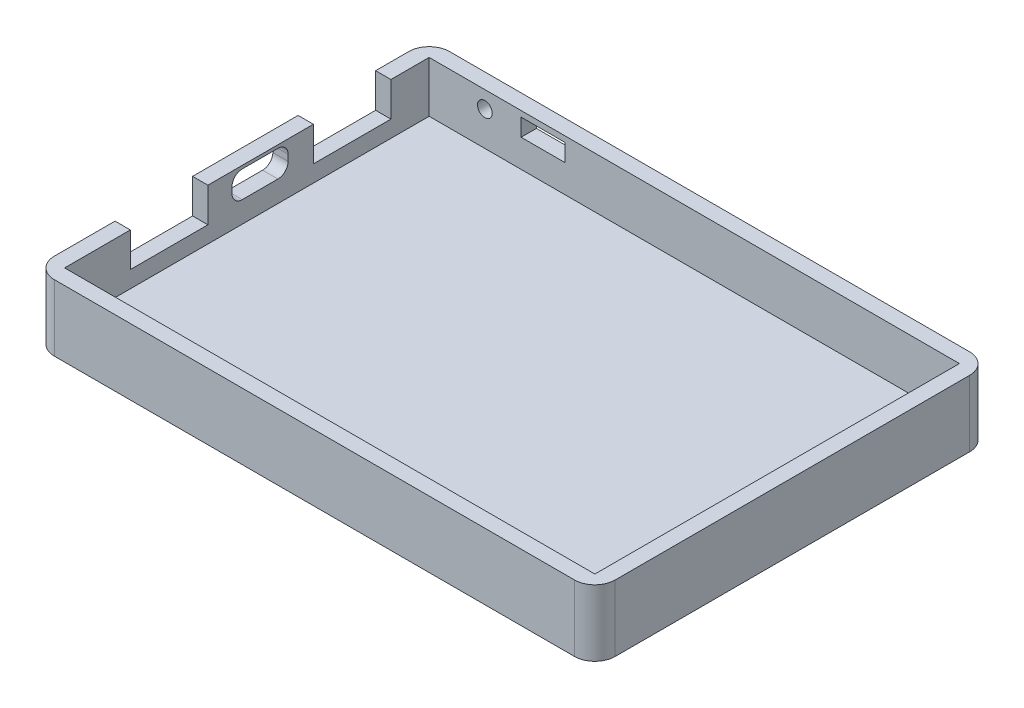
from build123d import *

# Parameters (mm, degrees)
SKETCH1_W           = 110
SKETCH1_H           = 77.5
SKETCH1_W_2         = 104
SKETCH1_H_2         = 71.5
BOSS_EXTRUDE1_DEPTH = 10
SKETCH1_2_W         = 110
SKETCH1_2_H         = 77.5
BOSS_EXTRUDE2_DEPTH = 3
CUT_EXTRUDE1_REACH  = 136.931
SKETCH3_W           = 15.2
SKETCH3_H           = 6.73
CUT_EXTRUDE2_REACH  = 136.931
SKETCH4_R           = 1.45
SKETCH4_W           = 8.6
SKETCH4_H           = 3.42
FILLET1_R           = 4


with BuildPart() as part:
    # Sketch1 → Boss-Extrude1 (new body)
    with BuildSketch(Plane(origin=(0, 0, 0), x_dir=(1, 0, 0), z_dir=(0, 1, 0))):
        with Locations((55, 38.75)):
            Rectangle(SKETCH1_W, SKETCH1_H)
        with Locations((55, 38.75)):
            Rectangle(SKETCH1_W_2, SKETCH1_H_2, mode=Mode.SUBTRACT)
    extrude(amount=BOSS_EXTRUDE1_DEPTH)

    # Sketch1<2> → Boss-Extrude2 (add)
    with BuildSketch(Plane(origin=(0, 0, 0), x_dir=(1, 0, 0), z_dir=(0, 1, 0))):
        with Locations((55, 38.75)):
            Rectangle(SKETCH1_2_W, SKETCH1_2_H)
    extrude(amount=-BOSS_EXTRUDE2_DEPTH)

    # Sketch3 → Cut-Extrude1 (cut, up to next)
    with BuildSketch(Plane.ZY, mode=Mode.PRIVATE) as cut_extrude1_sk1:
        with Locations((-23.5, 6.635)):
            Rectangle(SKETCH3_W, SKETCH3_H)
    cut_extrude1_tool1 = extrude(cut_extrude1_sk1.sketch, amount=-CUT_EXTRUDE1_REACH, mode=Mode.PRIVATE) & part.part
    # Sketch3 → Cut-Extrude1 (cut, up to next)
    with BuildSketch(Plane.ZY, mode=Mode.PRIVATE) as cut_extrude1_sk2:
        with Locations((-59.4, 6.635)):
            Rectangle(SKETCH3_W, SKETCH3_H)
    cut_extrude1_tool2 = extrude(cut_extrude1_sk2.sketch, amount=-CUT_EXTRUDE1_REACH, mode=Mode.PRIVATE) & part.part
    # Sketch3 → Cut-Extrude1 (cut, up to next)
    with BuildSketch(Plane.ZY, mode=Mode.PRIVATE) as cut_extrude1_sk3:
        with BuildLine():
            Line((-37.84, 9.38), (-44.840000134, 9.38))
            ThreePointArc((-44.840000134, 9.38), (-46.254213696, 8.794213562), (-46.840000134, 7.38))
            Line((-46.840000134, 7.38), (-46.840000134, 6.18))
            ThreePointArc((-46.840000134, 6.18), (-46.254213696, 4.765786438), (-44.840000134, 4.18))
            Line((-44.840000134, 4.18), (-37.84, 4.18))
            ThreePointArc((-37.84, 4.18), (-36.425786438, 4.765786438), (-35.84, 6.18))
            Line((-35.84, 6.18), (-35.84, 7.38))
            ThreePointArc((-35.84, 7.38), (-36.425786438, 8.794213562), (-37.84, 9.38))
        make_face()
    cut_extrude1_tool3 = extrude(cut_extrude1_sk3.sketch, amount=-CUT_EXTRUDE1_REACH, mode=Mode.PRIVATE) & part.part
    add(cut_extrude1_tool1.solids().sort_by_distance((0, 6.635, -23.5))[0], mode=Mode.SUBTRACT)
    add(cut_extrude1_tool2.solids().sort_by_distance((0, 6.635, -59.4))[0], mode=Mode.SUBTRACT)
    add(cut_extrude1_tool3.solids().sort_by_distance((0, 6.78, -41.34))[0], mode=Mode.SUBTRACT)

    # Sketch4 → Cut-Extrude2 (cut, up to next)
    with BuildSketch(Plane(origin=(0, 0, -77.5), x_dir=(-1, 0, 0), z_dir=(0, 0, -1)), mode=Mode.PRIVATE) as cut_extrude2_sk1:
        with Locations((-13.93, 6.69)):
            Circle(SKETCH4_R)
    cut_extrude2_tool1 = extrude(cut_extrude2_sk1.sketch, amount=-CUT_EXTRUDE2_REACH, mode=Mode.PRIVATE) & part.part
    # Sketch4 → Cut-Extrude2 (cut, up to next)
    with BuildSketch(Plane(origin=(0, 0, -77.5), x_dir=(-1, 0, 0), z_dir=(0, 0, -1)), mode=Mode.PRIVATE) as cut_extrude2_sk2:
        with Locations((-25.34, 7.17)):
            Rectangle(SKETCH4_W, SKETCH4_H)
    cut_extrude2_tool2 = extrude(cut_extrude2_sk2.sketch, amount=-CUT_EXTRUDE2_REACH, mode=Mode.PRIVATE) & part.part
    add(cut_extrude2_tool1.solids().sort_by_distance((13.93, 6.69, -77.5))[0], mode=Mode.SUBTRACT)
    add(cut_extrude2_tool2.solids().sort_by_distance((25.34, 7.17, -77.5))[0], mode=Mode.SUBTRACT)

    # Fillet1
    fillet1_edges = [part.edges().sort_by_distance(p)[0] for p in [
        (110, 3.5, -77.5),
        (0, 3.5, -77.5),
        (110, 3.5, 0),
        (0, 3.5, 0),
    ]]
    fillet(fillet1_edges, radius=FILLET1_R)


solid = part.part
